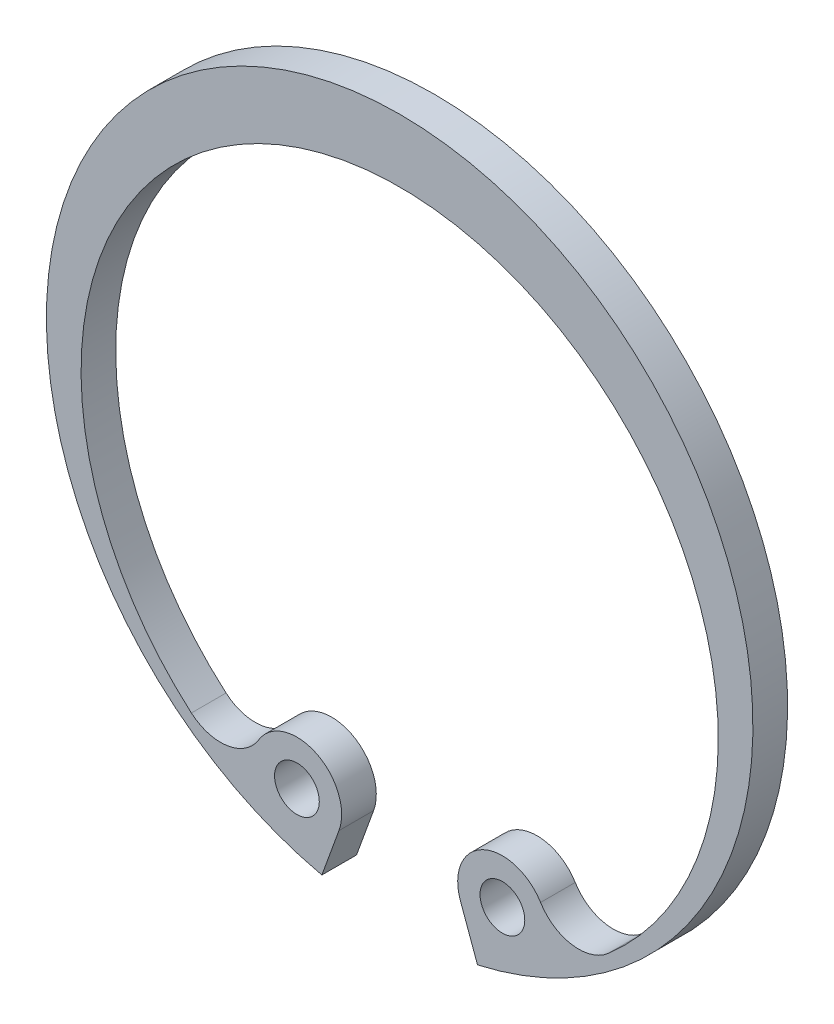
from build123d import *
from build123d.topology import SkipClean

# Parameters (mm, degrees)
SKETCH1_R                 = 7.9
EXTRUDE1_DEPTH            = 0.775
SKETCH34_R                = 0.5
F_056_250_SNAP_RING_DEPTH = 0.775
SKETCH35_R                = 7.9
CUT_EXTRUDE1_DEPTH        = 0.775


with BuildPart() as part:
    # Sketch1 → Extrude1 (new body)
    with BuildSketch(Plane.XY):
        Circle(SKETCH1_R)
    extrude(amount=EXTRUDE1_DEPTH)

    # Sketch34 → 056-250 Snap Ring (add)
    with SkipClean():  # the faces are left unmerged after this step: merging them gives an invalid solid
        with BuildSketch(Plane.XY.offset(0.775)):
            with BuildLine():
                Line((-1.357948468, -6.654737152), (-1.740532253, -7.705877463))
                ThreePointArc((-1.740532253, -7.705877463), (0, 7.9), (1.740532253, -7.705877463))
                Line((1.740532253, -7.705877463), (1.357948468, -6.654737152))
                ThreePointArc((1.357948468, -6.654737152), (1.863757747, -5.411747949), (3.15093243, -5.791282558))
                ThreePointArc((3.15093243, -5.791282558), (3.849974822, -6.257880122), (4.657974592, -6.026558003))
                ThreePointArc((4.657974592, -6.026558003), (0, 6.49), (-4.657974592, -6.026558003))
                ThreePointArc((-4.657974592, -6.026558003), (-3.849974822, -6.257880122), (-3.15093243, -5.791282558))
                ThreePointArc((-3.15093243, -5.791282558), (-1.863757747, -5.411747949), (-1.357948468, -6.654737152))
            make_face()
            with Locations((2.297641088, -6.312717009)):
                Circle(SKETCH34_R, mode=Mode.SUBTRACT)
            with Locations((-2.297641088, -6.312717009)):
                Circle(SKETCH34_R, mode=Mode.SUBTRACT)
        extrude(amount=F_056_250_SNAP_RING_DEPTH)

    # Sketch35 → Cut-Extrude1 (cut)
    with BuildSketch(Plane(origin=(0, 0, 0), x_dir=(-1, 0, 0), z_dir=(0, 0, -1))):
        Circle(SKETCH35_R)
    extrude(amount=-CUT_EXTRUDE1_DEPTH, mode=Mode.SUBTRACT)


solid = part.part
